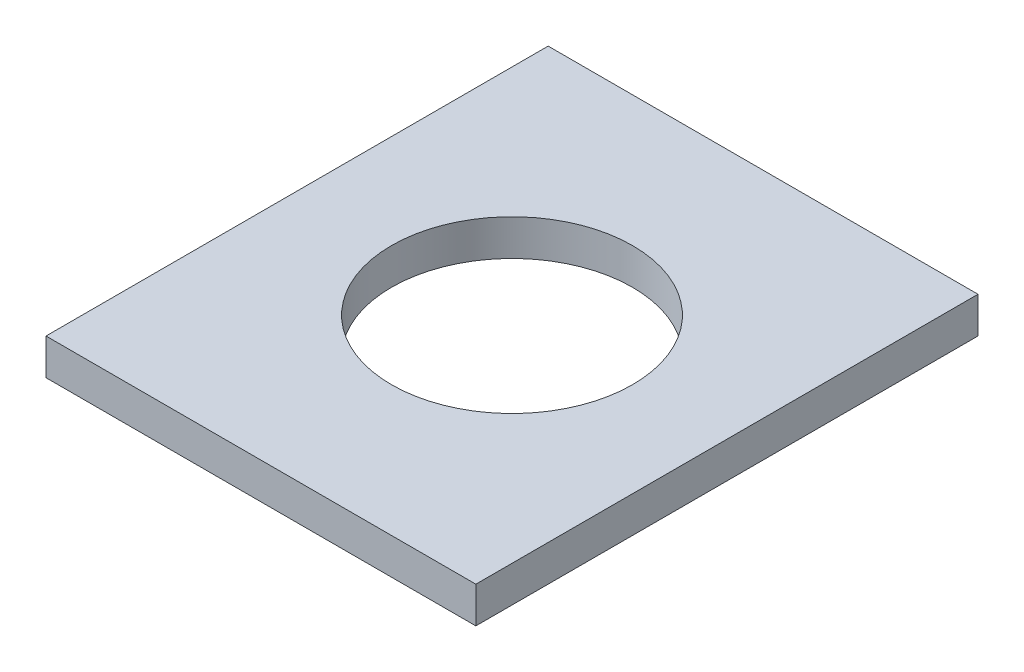
from build123d import *

# Parameters (mm, degrees)
SKETCH_1_W      = 214
SKETCH_1_H      = 250
SKETCH_1_R      = 60
EXTRUDE_1_DEPTH = 18


with BuildPart() as part:
    # 草图1 → 凸台-拉伸1 (new body)
    with BuildSketch(Plane(origin=(0, 0, 0), x_dir=(1, 0, 0), z_dir=(0, 1, 0))):
        Rectangle(SKETCH_1_W, SKETCH_1_H)
        Circle(SKETCH_1_R, mode=Mode.SUBTRACT)
    extrude(amount=EXTRUDE_1_DEPTH)


solid = part.part
